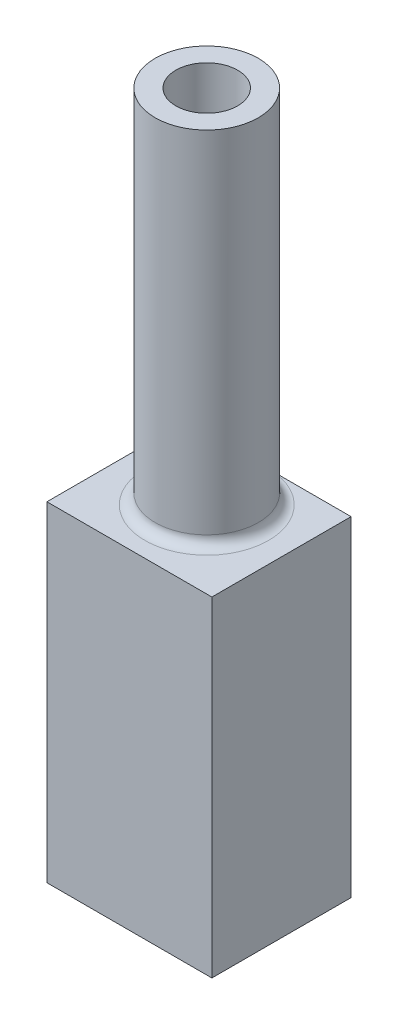
from build123d import *

# Parameters (mm, degrees)
BOSS_EXTRUDE1_DEPTH = 6
SKETCH2_R           = 5
BOSS_EXTRUDE2_DEPTH = 35
FILLET1_R           = 1
SKETCH3_W           = 16
SKETCH3_H           = 32
BOSS_EXTRUDE3_DEPTH = 1.5
CUT_EXTRUDE1_REACH  = 69.891
SKETCH4_R           = 3


with BuildPart() as part:
    # Sketch1 → Boss-Extrude1 (new, symmetric)
    with BuildSketch(Plane.XY):
        Polygon((-6, -14), (-6, 14), (6, 14), (6, -14), (4, -14), (4, -16), (8, -16), (8, 16), (-8, 16), (-8, -16), (-4, -16), (-4, -14), align=None)
    extrude(amount=BOSS_EXTRUDE1_DEPTH, both=True)

    # Sketch2 → Boss-Extrude2 (add)
    with BuildSketch(Plane(origin=(0, 16, 0), x_dir=(1, 0, 0), z_dir=(0, 1, 0))):
        with Locations(Location((0, 0, 0), (0, 0, 270))):
            Circle(SKETCH2_R)
    extrude(amount=BOSS_EXTRUDE2_DEPTH)

    # Fillet1
    fillet1_edges = [part.edges().sort_by_distance(p)[0] for p in [
        (0, 16, -5),
    ]]
    fillet(fillet1_edges, radius=FILLET1_R - 0.0001)  # a hair under: the kernel refuses the full size

    # Sketch3 → Boss-Extrude3 (add)
    with BuildSketch(Plane.XY.offset(6)):
        Rectangle(SKETCH3_W, SKETCH3_H)
    extrude(amount=BOSS_EXTRUDE3_DEPTH)

    # Sketch4 → Cut-Extrude1 (cut, up to next)
    with BuildSketch(Plane(origin=(0, 51, 0), x_dir=(1, 0, 0), z_dir=(0, 1, 0)), mode=Mode.PRIVATE) as cut_extrude1_sk1:
        with Locations(Location((0, 0, 0), (0, 0, 270))):
            Circle(SKETCH4_R)
    cut_extrude1_tool1 = extrude(cut_extrude1_sk1.sketch, amount=-CUT_EXTRUDE1_REACH, mode=Mode.PRIVATE) & part.part
    add(cut_extrude1_tool1.solids().sort_by_distance((0, 51, 0))[0], mode=Mode.SUBTRACT)


solid = part.part
